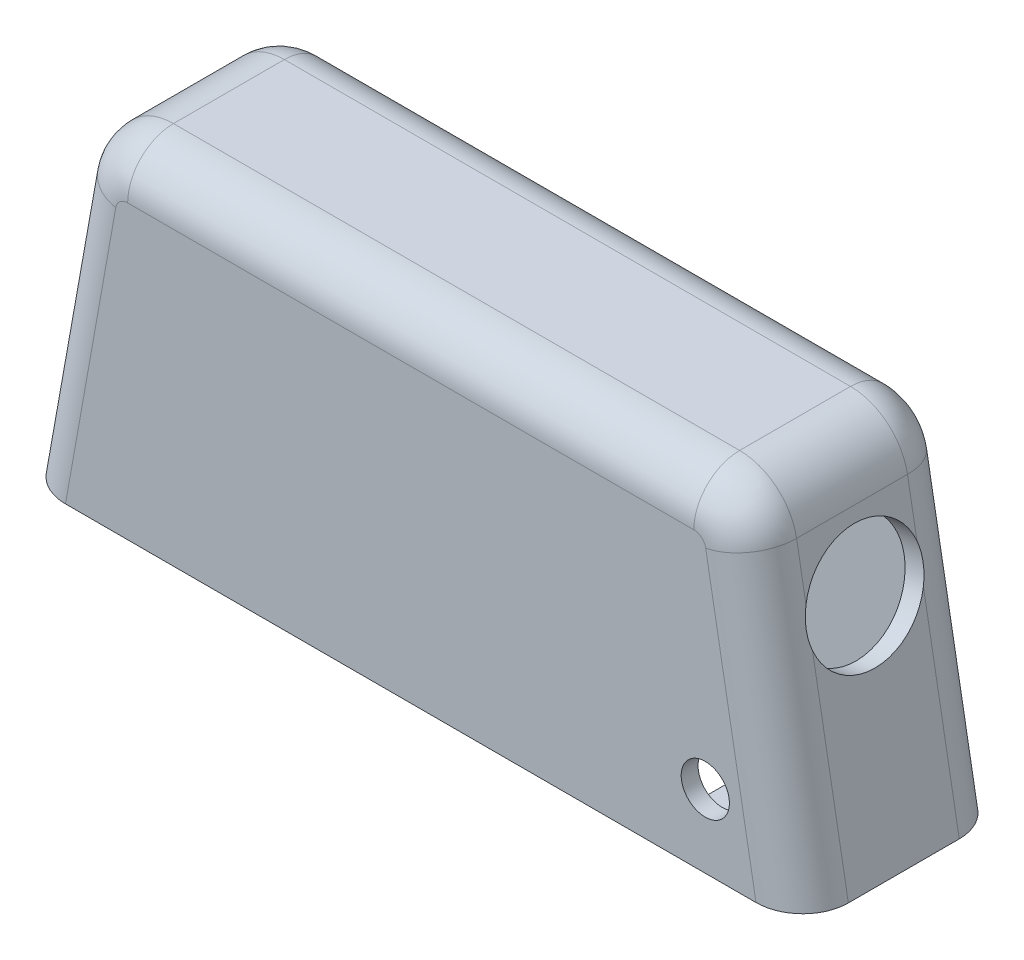
from build123d import *

# Parameters (mm, degrees)
BOSS_EXTRUDE1_DEPTH = 1.8
BOSS_EXTRUDE2_DEPTH = 15
SKETCH3_R           = 4.85
CUT_EXTRUDE1_DEPTH  = 15
SKETCH4_R           = 4.85
CUT_EXTRUDE2_DEPTH  = 15
FILLET1_R           = 3
FILLET2_R           = 4.8
FILLET3_R           = 2
FILLET4_R           = 3.8
BOSS_EXTRUDE3_DEPTH = 1.4
SKETCH6_R           = 2
CUT_EXTRUDE3_DEPTH  = 1.4
BOSS_EXTRUDE4_DEPTH = 1.4
SKETCH8_W           = 41
SKETCH8_H           = 13.6
CUT_EXTRUDE4_DEPTH  = 4.4
FILLET5_R           = 1.8
FILLET6_R           = 3.8


with BuildPart() as part:
    # Sketch1 → Boss-Extrude1 (new body)
    with BuildSketch(Plane.XY):
        Polygon((0, 0), (65, 0), (60, 28), (5, 28), align=None)
    extrude(amount=BOSS_EXTRUDE1_DEPTH)

    # Sketch2 → Boss-Extrude2 (add)
    with BuildSketch(Plane.XY.offset(1.8)):
        Polygon((5, 28), (60, 28), (65, 0), (0, 0), align=None)
        Polygon((6.518195748, 26.4), (58.660404268, 26.4), (63.088975697, 1.6), (2.08962432, 1.6), align=None, mode=Mode.SUBTRACT)
    extrude(amount=BOSS_EXTRUDE2_DEPTH)

    # Sketch3 → Cut-Extrude1 (cut)
    with BuildSketch(Plane(origin=(62.991347342, 11.248454883, 0), x_dir=(0, 0, -1), z_dir=(0.9844275755084821, 0.17579063848365745, 0))):
        with Locations(Location((-8.4, 7.016533805, 0), (0, 0, 90))):
            Circle(SKETCH3_R)
    extrude(amount=-CUT_EXTRUDE1_DEPTH, mode=Mode.SUBTRACT)

    # Sketch4 → Cut-Extrude2 (cut)
    with BuildSketch(Plane(origin=(0, 0, 0), x_dir=(0, 0, 1), z_dir=(-0.9844275755084821, 0.17579063848365759, 0))):
        with Locations(Location((8.4, 18.442925307, 0), (0, 0, 270))):
            Circle(SKETCH4_R)
    extrude(amount=-CUT_EXTRUDE2_DEPTH, mode=Mode.SUBTRACT)

    # Fillet1
    fillet1_edges = [part.edges().sort_by_distance(p)[0] for p in [
        (58.660404268, 26.4, 9.3),
        (6.518195748, 26.4, 9.3),
    ]]
    fillet(fillet1_edges, radius=FILLET1_R)

    # Fillet2
    fillet2_edges = [part.edges().sort_by_distance(p)[0] for p in [
        (5, 28, 8.4),
        (60, 28, 8.4),
    ]]
    fillet(fillet2_edges, radius=FILLET2_R)

    # Fillet3
    fillet3_edges = [part.edges().sort_by_distance(p)[0] for p in [
        (61.095460347, 12.763685958, 1.8),
        (32.589300008, 26.4, 1.8),
        (4.083139669, 12.763685958, 1.8),
        (58.07452367, 25.700229961, 1.8),
        (7.104076347, 25.700229961, 1.8),
    ]]
    fillet(fillet3_edges, radius=FILLET3_R)

    # Fillet4
    # the kernel refuses this fillet: 3.8 mm, written as the material it takes off along each edge
    with BuildSketch(Plane(origin=(55.981212805, 28, 0), x_dir=(0, 0, 1), z_dir=(-1, 0, 0))) as fillet4_piece_1:
        with BuildLine():
            CenterArc((FILLET4_R, -FILLET4_R), FILLET4_R, 90, 90)
            Line((0, -FILLET4_R), (0, 0))
            Line((0, 0), (FILLET4_R, 0))
        make_face()
    extrude(amount=46.962425609, mode=Mode.SUBTRACT)
    with BuildSketch(Plane(origin=(66.670011066, -9.352061967, 0), x_dir=(0, 0, 1), z_dir=(-0.17579063848365728, 0.9844275755084821, 0)), Plane(origin=(4.293534833, 24.043795065, 0), x_dir=(0, 0, 1), z_dir=(-0.17579063848365753, -0.984427575508482, 0))) as fillet4_piece_2:
        with BuildLine():
            CenterArc((FILLET4_R, -FILLET4_R), FILLET4_R, 90, 90)
            Line((0, -FILLET4_R), (0, 0))
            Line((0, 0), (FILLET4_R, 0))
        make_face()
    extrude(amount=33.924138111, mode=Mode.SUBTRACT)
    with BuildSketch(Plane(origin=(9.018787195, 23.2, 0), x_dir=(0, 1, 0), z_dir=(1, 0, 0))) as fillet4_piece_3:
        with BuildLine():
            CenterArc((4.8 - FILLET4_R, FILLET4_R), FILLET4_R, 270, 90)
            Line((4.8 - FILLET4_R, 0), (4.8, 0))
            Line((4.8, 0), (4.8, FILLET4_R))
        make_face()
    revolve(axis=Axis((9.018787195, 23.2, 0), (0, 0, 1)), revolution_arc=79.875328345, mode=Mode.SUBTRACT)
    with BuildSketch(Plane(origin=(55.981212805, 23.2, 0), x_dir=(0, 1, 0), z_dir=(-1, 0, 0))) as fillet4_piece_4:
        with BuildLine():
            CenterArc((4.8 - FILLET4_R, -FILLET4_R), FILLET4_R, 0, 90)
            Line((4.8 - FILLET4_R, 0), (4.8, 0))
            Line((4.8, 0), (4.8, -FILLET4_R))
        make_face()
    revolve(axis=Axis((55.981212805, 23.2, 0), (0, 0, -1)), revolution_arc=79.875328345, mode=Mode.SUBTRACT)

    # Sketch5 → Boss-Extrude3 (add)
    with BuildSketch(Plane.XY.offset(16.8)):
        Polygon((2.08962432, 1.6), (62.853232584, 1.6), (63.866257319, 1.6), (62.171786683, 12.021897532), (3.201344626, 12.021897532), (1.273741814, 1.6), align=None)
    extrude(amount=-BOSS_EXTRUDE3_DEPTH)

    # Sketch6 → Cut-Extrude3 (cut)
    with BuildSketch(Plane.XY.offset(16.8)):
        with Locations((56.933372232, 6.033926522)):
            Circle(SKETCH6_R)
    extrude(amount=-CUT_EXTRUDE3_DEPTH, mode=Mode.SUBTRACT)

    # Sketch7 → Boss-Extrude4 (add)
    with BuildSketch(Plane.XY.offset(16.8)):
        Polygon((6.155527083, 26.711603316), (3.95067745, 17.333364545), (3.95067745, 12.021897532), (61.507859388, 12.021897532), (61.507859388, 17.333364545), (58.93189058, 26.711603316), align=None)
    extrude(amount=-BOSS_EXTRUDE4_DEPTH)

    # Sketch8 → Cut-Extrude4 (cut)
    with BuildSketch(Plane(origin=(0, 0, 0), x_dir=(-1, 0, 0), z_dir=(0, -1, 0))):
        with Locations((-32.5, -8.6)):
            Rectangle(SKETCH8_W, SKETCH8_H)
    extrude(amount=-CUT_EXTRUDE4_DEPTH, mode=Mode.SUBTRACT)

    # Fillet5
    fillet5_edges = [part.edges().sort_by_distance(p)[0] for p in [
        (61.095460347, 12.763685958, 15.4),
        (4.083139669, 12.763685958, 15.4),
        (58.07452367, 25.700229961, 15.4),
        (7.104076347, 25.700229961, 15.4),
        (32.589300008, 26.4, 15.4),
    ]]
    fillet(fillet5_edges, radius=FILLET5_R)

    # Fillet6
    # the kernel refuses this fillet: 3.8 mm, written as the material it takes off along each edge
    with BuildSketch(Plane(origin=(60.706465167, 24.043795065, 16.8), x_dir=(-0.984427575508482, -0.17579063848365725, 0), z_dir=(0.17579063848365728, -0.9844275755084821, 0))) as fillet6_piece_1:
        with BuildLine():
            CenterArc((FILLET6_R, FILLET6_R), FILLET6_R, 180, 90)
            Line((0, FILLET6_R), (0, 0))
            Line((0, 0), (FILLET6_R, 0))
        make_face()
    extrude(amount=33.924138111, mode=Mode.SUBTRACT)
    with BuildSketch(Plane(origin=(9.018787195, 28, 16.8), x_dir=(0, -1, 0), z_dir=(1, 0, 0))) as fillet6_piece_2:
        with BuildLine():
            CenterArc((FILLET6_R, FILLET6_R), FILLET6_R, 180, 90)
            Line((0, FILLET6_R), (0, 0))
            Line((0, 0), (FILLET6_R, 0))
        make_face()
    extrude(amount=46.962425609, mode=Mode.SUBTRACT)
    with BuildSketch(Plane(origin=(-1.670011066, -9.352061967, 16.8), x_dir=(0, 0, -1), z_dir=(0.17579063848365753, 0.984427575508482, 0))) as fillet6_piece_3:
        with BuildLine():
            CenterArc((FILLET6_R, -FILLET6_R), FILLET6_R, 90, 90)
            Line((0, -FILLET6_R), (0, 0))
            Line((0, 0), (FILLET6_R, 0))
        make_face()
    extrude(amount=33.924138111, mode=Mode.SUBTRACT)
    with BuildSketch(Plane(origin=(9.018787195, 23.2, 16.8), x_dir=(0, 1, 0), z_dir=(1, 0, 0))) as fillet6_piece_4:
        with BuildLine():
            CenterArc((4.8 - FILLET6_R, -FILLET6_R), FILLET6_R, 0, 90)
            Line((4.8 - FILLET6_R, 0), (4.8, 0))
            Line((4.8, 0), (4.8, -FILLET6_R))
        make_face()
    revolve(axis=Axis((9.018787195, 23.2, 16.8), (0, 0, 1)), revolution_arc=79.875328345, mode=Mode.SUBTRACT)
    with BuildSketch(Plane(origin=(55.981212805, 23.2, 16.8), x_dir=(0, 1, 0), z_dir=(-1, 0, 0))) as fillet6_piece_5:
        with BuildLine():
            CenterArc((4.8 - FILLET6_R, FILLET6_R), FILLET6_R, 270, 90)
            Line((4.8, FILLET6_R), (4.8, 0))
            Line((4.8, 0), (4.8 - FILLET6_R, 0))
        make_face()
    revolve(axis=Axis((55.981212805, 23.2, 16.8), (0, 0, -1)), revolution_arc=79.875328345, mode=Mode.SUBTRACT)


solid = part.part
